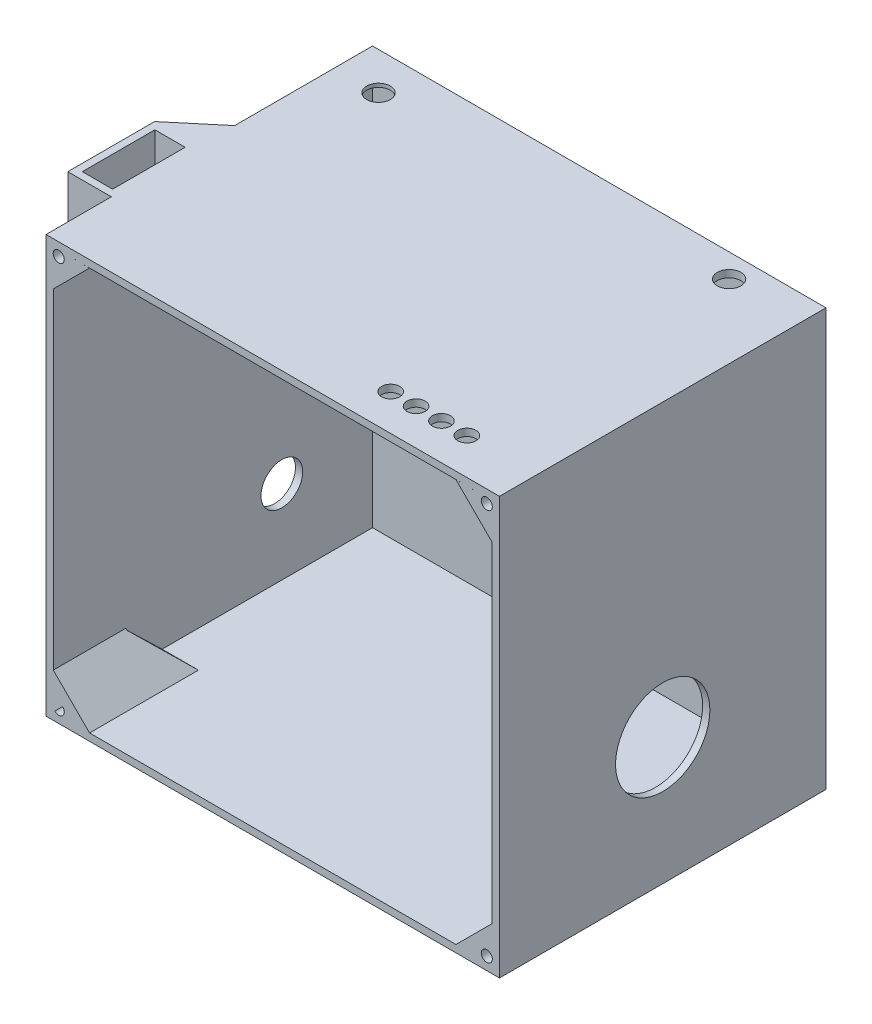
from build123d import *
from OCP.BRepFilletAPI import BRepFilletAPI_MakeChamfer

# Parameters (mm, degrees)
SKETCH1_W              = 125
SKETCH1_H              = 90
BOSS_EXTRUDE1_DEPTH    = 115
SHELL1_T               = -2
SKETCH4_W              = 67.8
SKETCH4_H              = 16.7
CUT_EXTRUDE1_DEPTH     = 1
SKETCH5_R              = 3.25
CUT_EXTRUDE2_DEPTH     = 37
SKETCH6_W              = 1
SKETCH6_H              = 111
BOSS_EXTRUDE2_DEPTH    = 10
FILLET1_SIZE           = 4
FILLET1_SIZE_2         = 10
FILLET2_R              = 1
SKETCH7_R              = 13
CUT_EXTRUDE3_DEPTH     = 10
SKETCH8_W              = 24
SKETCH8_H              = 49.041471127
BOSS_EXTRUDE3_DEPTH    = 12
CHAMFER1_SIZE          = 10
CHAMFER1_SIZE2         = 11.917535926
CUT_EXTRUDE4_DEPTH     = 40
SKETCH10_R             = 1.4
BOSS_EXTRUDE4_DEPTH    = 10
FILLET3_R              = 1
SKETCH11_R             = 3.25
CUT_EXTRUDE5_DEPTH     = 161
SKETCH13_R             = 5.75
CUT_EXTRUDE6_DEPTH     = 161
SKETCH14_R             = 6
SKETCH14_R_2           = 5.5
BOSS_EXTRUDE5_DEPTH    = 1
FILLET4_R              = 0.5
FILLET5_R              = 0.5
CUT_EXTRUDE7_DEPTH     = 9
BOSS_EXTRUDE6_DEPTH    = 20
CHAMFER2_SIZE          = 10
CHAMFER2_SIZE2         = 9.656887748
CHAMFER3_SIZE          = 5
CHAMFER3_SIZE2         = 9.813052528
CUT_EXTRUDE8_START     = -18
CUT_EXTRUDE8_OUTLINE_R = 1.525
CUT_EXTRUDE8_DEPTH     = 18


# Read off the part's stored shape, not the designer's step: Cut-Extrude8
# Some blends are built 0.0001 mm under size
with BuildPart() as part:
    # Sketch1 → Boss-Extrude1 (new body)
    with BuildSketch(Plane(origin=(0, 0, 0), x_dir=(1, 0, 0), z_dir=(0, 1, 0))):
        Rectangle(SKETCH1_W, SKETCH1_H)
    extrude(amount=BOSS_EXTRUDE1_DEPTH)

    # Shell1
    shell1_openings = [part.faces().sort_by_distance(p)[0] for p in [
        (0, 57.5, 45),
    ]]
    offset(amount=SHELL1_T, openings=shell1_openings, kind=Kind.INTERSECTION)

    # Sketch4 → Cut-Extrude1 (cut)
    with BuildSketch(Plane.XZ.offset(-113)):
        with Locations((-26.6, -34.65)):
            Rectangle(SKETCH4_W, SKETCH4_H)
    extrude(amount=-CUT_EXTRUDE1_DEPTH, mode=Mode.SUBTRACT)

    # Sketch5 → Cut-Extrude2 (cut)
    with BuildSketch(Plane.XZ.offset(-114)):
        with Locations(Location((-50.5, -34.65, 0), (0, 0, 270))):
            Circle(SKETCH5_R)
    extrude(amount=-CUT_EXTRUDE2_DEPTH, mode=Mode.SUBTRACT)

    # Sketch6 → Boss-Extrude2 (add)
    with BuildSketch(Plane.XY.offset(-43)):
        with Locations((7.8, 57.5)):
            Rectangle(SKETCH6_W, SKETCH6_H)
    extrude(amount=BOSS_EXTRUDE2_DEPTH)

    # Fillet1
    # an asymmetric fillet: 10, 4 mm, written as the material it adds along each edge
    with BuildSketch(Plane(origin=(8.3, 2, -43), x_dir=(1, 0, 0), z_dir=(0, 1, 0))) as fillet1_piece_1:
        with BuildLine():
            Bezier((FILLET1_SIZE, 0), (0, 0), (0, -FILLET1_SIZE_2), weights=[1, 0.707106781, 1])
            Line((0, -FILLET1_SIZE_2), (0, 0))
            Line((0, 0), (FILLET1_SIZE, 0))
        make_face()
    extrude(amount=111)

    # Fillet2
    fillet2_edges = [part.edges().sort_by_distance(p)[0] for p in [
        (8.3, 57.5, -33),
    ]]
    fillet(fillet2_edges, radius=FILLET2_R)

    # Sketch7 → Cut-Extrude3 (cut)
    with BuildSketch(Plane(origin=(62.5, 0, 0), x_dir=(0, 0, -1), z_dir=(1, 0, 0))):
        with Locations((0, 35)):
            Circle(SKETCH7_R)
    extrude(amount=-CUT_EXTRUDE3_DEPTH, mode=Mode.SUBTRACT)

    # Sketch8 → Boss-Extrude3 (add)
    with BuildSketch(Plane.ZY.offset(62.5)):
        with Locations((15, 90.479264437)):
            Rectangle(SKETCH8_W, SKETCH8_H)
    extrude(amount=BOSS_EXTRUDE3_DEPTH)

    # Chamfer1
    chamfer1_edges = [part.edges().sort_by_distance(p)[0] for p in [
        (-62.5, 90.479264436, 3),
    ]]
    chamfer1_side = [part.faces().sort_by_distance(p)[0] for p in [
        (-62.5, 53.268405144, -1.924661569),
    ]]
    chamfer(chamfer1_edges, length=CHAMFER1_SIZE, length2=CHAMFER1_SIZE2, reference=chamfer1_side[0])

    # Sketch9 → Cut-Extrude4 (cut)
    with BuildSketch(Plane(origin=(0, 115, 0), x_dir=(1, 0, 0), z_dir=(0, 1, 0))):
        Polygon((-64.139712889, -5), (-72.5, -5), (-72.5, -21.393203559), (-72.5, -25), (-64.139712889, -25), align=None)
    extrude(amount=-CUT_EXTRUDE4_DEPTH, mode=Mode.SUBTRACT)

    # Sketch10 → Boss-Extrude4 (add)
    with BuildSketch(Plane.XY.offset(-43)):
        with Locations((22.3, 78.5)):
            Circle(SKETCH10_R)
        with Locations(Location((51.3, 78.5, 0), (0, 0, 180))):
            Circle(SKETCH10_R)
        with Locations((51.3, 105)):
            Circle(SKETCH10_R)
        with Locations(Location((22.3, 105, 0), (0, 0, 180))):
            Circle(SKETCH10_R)
    extrude(amount=BOSS_EXTRUDE4_DEPTH)

    # Fillet3
    fillet3_edges = [part.edges().sort_by_distance(p)[0] for p in [
        (23.7, 105, -43),
        (49.9, 105, -43),
        (52.7, 78.5, -43),
        (20.9, 78.5, -43),
    ]]
    fillet(fillet3_edges, radius=FILLET3_R)

    # Sketch11 → Cut-Extrude5 (cut)
    with BuildSketch(Plane.XZ.offset(-113)):
        with Locations(Location((42.3, -38.5, 0), (0, 0, 270))):
            Circle(SKETCH11_R)
    extrude(amount=-CUT_EXTRUDE5_DEPTH, mode=Mode.SUBTRACT)

    # Sketch13 → Cut-Extrude6 (cut)
    with BuildSketch(Plane(origin=(-60.5, 0, 0), x_dir=(0, 0, -1), z_dir=(1, 0, 0))):
        with Locations((18, 25)):
            Circle(SKETCH13_R)
    extrude(amount=-CUT_EXTRUDE6_DEPTH, mode=Mode.SUBTRACT)

    # Sketch14 → Boss-Extrude5 (add)
    # profile 1 of 4: a face of its own
    with BuildSketch(Plane.XZ):
        with Locations(Location((-55.5, 38, 0), (0, 0, 270))):
            Circle(SKETCH14_R)
        with Locations(Location((-55.5, 38, 0), (0, 0, 270))):
            Circle(SKETCH14_R_2, mode=Mode.SUBTRACT)
    # profile 2 of 4: a face of its own
    with BuildSketch(Plane.XZ):
        with Locations(Location((55.5, 38, 0), (0, 0, 270))):
            Circle(SKETCH14_R)
        with Locations(Location((55.5, 38, 0), (0, 0, 270))):
            Circle(SKETCH14_R_2, mode=Mode.SUBTRACT)
    # profile 3 of 4: a face of its own
    with BuildSketch(Plane.XZ):
        with Locations(Location((55.5, -38, 0), (0, 0, 270))):
            Circle(SKETCH14_R)
        with Locations(Location((55.5, -38, 0), (0, 0, 270))):
            Circle(SKETCH14_R_2, mode=Mode.SUBTRACT)
    # profile 4 of 4: a face of its own
    with BuildSketch(Plane.XZ):
        with Locations(Location((-55.5, -38, 0), (0, 0, 270))):
            Circle(SKETCH14_R)
    extrude(amount=BOSS_EXTRUDE5_DEPTH)

    # Fillet4
    fillet4_edges = [part.edges().sort_by_distance(p)[0] for p in [
        (-55.5, -1, 44),
        (-55.5, 0, 44),
    ]]
    fillet(fillet4_edges, radius=FILLET4_R - 0.0001)  # a hair under: the kernel refuses the full size

    # Fillet5
    fillet5_edges = [part.edges().sort_by_distance(p)[0] for p in [
        (55.5, 0, -32),
        (55.5, -1, -32),
        (55.5, 0, 44),
        (55.5, -1, 44),
        (-55.5, 0, -32),
        (-55.5, -1, -32),
    ]]
    fillet(fillet5_edges, radius=FILLET5_R - 0.0001)  # a hair under: the kernel refuses the full size

    # Sketch17 → Cut-Extrude7 (cut)
    with BuildSketch(Plane(origin=(0, 115, 0), x_dir=(1, 0, 0), z_dir=(0, 1, 0))):
        with BuildLine():
            ThreePointArc((25, -35), (20.732233047, -33.232233047), (22.5, -37.5))
            Line((22.5, -37.5), (22.5, -35))
            Line((22.5, -35), (25, -35))
        make_face()
        with BuildLine():
            Line((22.5, -35), (22.5, -37.5))
            ThreePointArc((22.5, -37.5), (24.267766953, -36.767766953), (25, -35))
            Line((25, -35), (22.5, -35))
        make_face()
        with BuildLine():
            ThreePointArc((32, -35), (29.5, -32.5), (27, -35))
            Line((27, -35), (32, -35))
        make_face()
        with BuildLine():
            Line((32, -35), (27, -35))
            ThreePointArc((27, -35), (29.5, -37.5), (32, -35))
        make_face()
        with BuildLine():
            ThreePointArc((39, -35), (36.5, -32.5), (34, -35))
            Line((34, -35), (39, -35))
        make_face()
        with BuildLine():
            Line((39, -35), (34, -35))
            ThreePointArc((34, -35), (36.5, -37.5), (39, -35))
        make_face()
        with BuildLine():
            ThreePointArc((46, -35), (43.5, -32.5), (41, -35))
            Line((41, -35), (46, -35))
        make_face()
        with BuildLine():
            Line((46, -35), (41, -35))
            ThreePointArc((41, -35), (43.5, -37.5), (46, -35))
        make_face()
    extrude(amount=-CUT_EXTRUDE7_DEPTH, mode=Mode.SUBTRACT)

    # Sketch18 → Boss-Extrude6 (add)
    with BuildSketch(Plane.XY.offset(45)):
        Polygon((-50.5, 2), (-60.5, 12), (-60.5, 2), align=None)
        Polygon((-60.5, 113), (-60.5, 103), (-50.5, 112.988112704), align=None)
        Polygon((50.5, 112.988112704), (60.5, 103), (60.5, 113), align=None)
        Polygon((60.5, 12), (50.5, 2), (60.5, 2), align=None)
    extrude(amount=-BOSS_EXTRUDE6_DEPTH)

    # Chamfer2
    chamfer2_edges = [part.edges().sort_by_distance(p)[0] for p in [
        (-55.5, 2, 25),
        (55.5, 2, 25),
    ]]
    chamfer2_side = [part.faces().sort_by_distance(p)[0] for p in [
        (-0.015179925, 2, -0.25697617),
    ]]
    chamfer(chamfer2_edges, length=CHAMFER2_SIZE, length2=CHAMFER2_SIZE2, reference=chamfer2_side[0])

    # Chamfer3: one chamfer whose edges measure the first distance from different faces: ONE call of the kernel's chamfer builder (chamfer() names one face for all edges)
    chamfer3_edges_1 = [part.edges().sort_by_distance(p)[0] for p in [
        (-60.5, 108, 25),
    ]]
    chamfer3_side_1 = [part.faces().sort_by_distance(p)[0] for p in [
        (-60.5, 58.240348279, -0.431861074),
    ]]
    chamfer3_edges_2 = [part.edges().sort_by_distance(p)[0] for p in [
        (60.5, 108, 25),
    ]]
    chamfer3_side_2 = [part.faces().sort_by_distance(p)[0] for p in [
        (60.5, 59.1464465, -0.600556504),
    ]]
    chamfer3 = BRepFilletAPI_MakeChamfer(part.part.solid().wrapped)
    for e in chamfer3_edges_1:
        chamfer3.Add(CHAMFER3_SIZE, CHAMFER3_SIZE2, e.wrapped, chamfer3_side_1[0].wrapped)  # the first distance lies on this face
    for e in chamfer3_edges_2:
        chamfer3.Add(CHAMFER3_SIZE, CHAMFER3_SIZE2, e.wrapped, chamfer3_side_2[0].wrapped)  # the first distance lies on this face
    add(Compound.cast(chamfer3.Shape()), mode=Mode.REPLACE)

    # Cut-Extrude8 outline → Cut-Extrude8 (cut)
    with BuildSketch(Plane.XY.offset(45).offset(CUT_EXTRUDE8_START)):
        with BuildLine():
            Line((59.282778619, 112.998553053), (58.713659436, 112.997876524))
            ThreePointArc((58.713659436, 112.997876524), (59.001812812, 109.975001077), (59.282778619, 112.998553053))
        make_face()
        with BuildLine():
            Line((-58.713659436, 112.997876524), (-59.282778619, 112.998553053))
            ThreePointArc((-59.282778619, 112.998553053), (-59.001812812, 109.975001077), (-58.713659436, 112.997876524))
        make_face()
        with BuildLine():
            Line((58.725, 113), (59.275, 113))
            ThreePointArc((59.275, 113), (59, 113.025), (58.725, 113))
        make_face()
        with Locations((59, 3.5)):
            Circle(CUT_EXTRUDE8_OUTLINE_R)
        with BuildLine():
            Line((-57.921662159, 4.578337841), (-60.078337841, 2.421662159))
            ThreePointArc((-60.078337841, 2.421662159), (-57.921662159, 2.421662159), (-57.921662159, 4.578337841))
        make_face()
    extrude(amount=CUT_EXTRUDE8_DEPTH, mode=Mode.SUBTRACT)


solid = part.part
